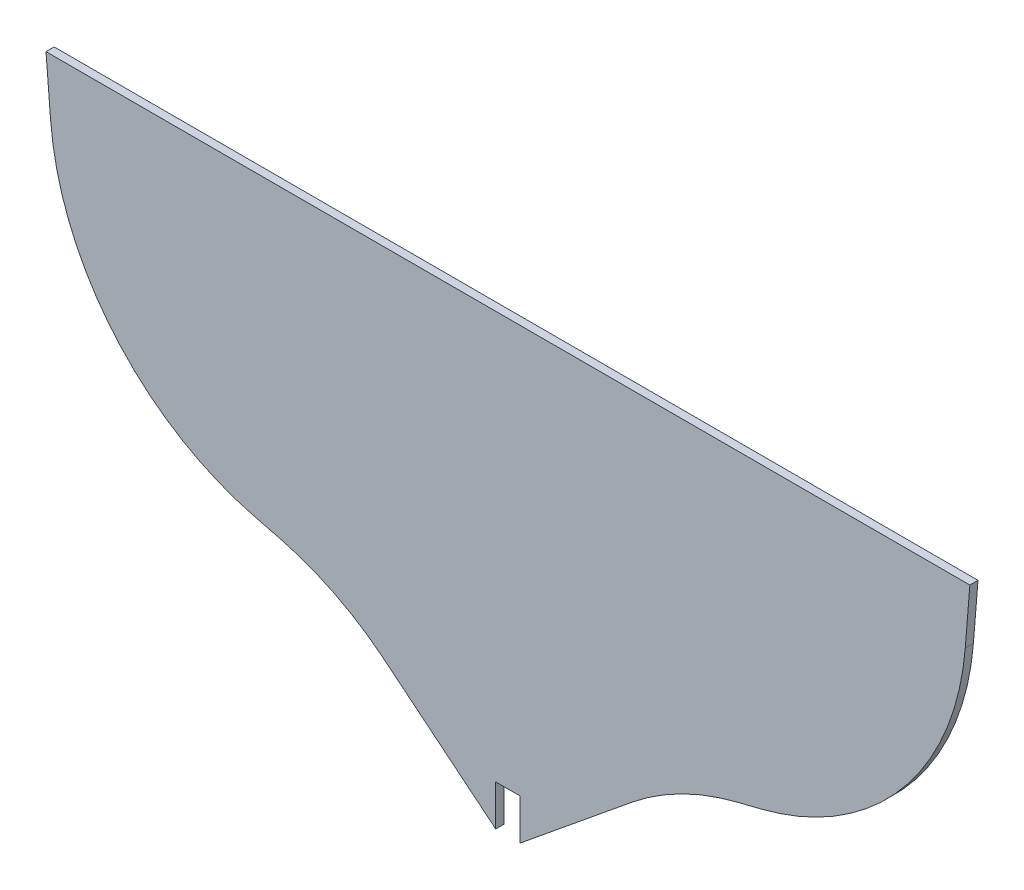
from build123d import *

# Parameters (mm, degrees)
BOSS_EXTRU_1_DEPTH = 3
CONG_1_R           = 100


with BuildPart() as part:
    # Esquisse1 → Boss.-Extru.1 (new body)
    with BuildSketch(Plane.XY):
        Polygon((-133.923413348, 132.631604979), (206.076586652, 132.631604979), (198.592642569, 40.076546408), (98.886578994, 15.247354485), (40.576586652, -32.368395021), (40.576586652, -17.368395021), (31.576586652, -17.368395021), (31.576586652, -32.368395021), (-26.73340569, 15.247354485), (-126.439469265, 40.076546408), align=None)
    extrude(amount=BOSS_EXTRU_1_DEPTH)

    # Congé1
    cong_1_edges = [part.edges().sort_by_distance(p)[0] for p in [
        (198.592642569, 40.076546408, 1.5),
        (98.886578994, 15.247354485, 1.5),
        (-26.73340569, 15.247354485, 1.5),
        (-126.439469265, 40.076546408, 1.5),
    ]]
    fillet(cong_1_edges, radius=CONG_1_R)


solid = part.part
